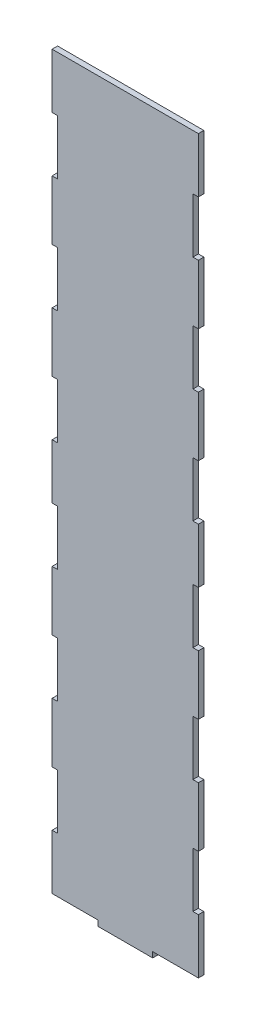
from build123d import *

# Parameters (mm, degrees)
RESSALTO_EXTRUS_O1_DEPTH = 3
ESBO_O2_OUTSIDE_W        = 248.722
ESBO_O2_OUTSIDE_H        = 491.722
CORTE_EXTRUS_O1_DEPTH    = 219.215489826
ESBO_O3_W                = 3
ESBO_O3_H                = 30
CORTE_EXTRUS_O2_DEPTH    = 219.215489826


with BuildPart() as part:
    # Esboço1 → Ressalto-extrusão1 (new body)
    with BuildSketch(Plane.XY):
        Polygon((-80, -200), (-55, -200), (-55, -203), (-25, -203), (-25, -200), (25, -200), (25, -203), (55, -203), (55, -200), (80, -200), (80, 200), (-80, 200), align=None)
    extrude(amount=RESSALTO_EXTRUS_O1_DEPTH)

    # Esboço2 outside → Corte-extrusão1 (cut, through all)
    with BuildSketch(Plane.XY.offset(3)):
        with Locations((0, -1.5)):
            Rectangle(ESBO_O2_OUTSIDE_W, ESBO_O2_OUTSIDE_H)
        Polygon((0, 200), (0, 170), (3, 170), (3, 140), (0, 140), (0, 107.5), (3, 107.5), (3, 77.5), (0, 77.5), (0, 45), (3, 45), (3, 15), (0, 15), (0, -15), (3, -15), (3, -45), (0, -45), (0, -77.5), (3, -77.5), (3, -107.5), (0, -107.5), (0, -140), (3, -140), (3, -170), (0, -170), (0, -200), (25, -200), (25, -203), (55, -203), (55, -200), (80, -200), (80, 200), align=None, mode=Mode.SUBTRACT)
    extrude(amount=-CORTE_EXTRUS_O1_DEPTH, mode=Mode.SUBTRACT)

    # Esboço3 → Corte-extrusão2 (cut, through all)
    with BuildSketch(Plane.XY.offset(3)):
        with Locations((78.5, 155)):
            Rectangle(ESBO_O3_W, ESBO_O3_H)
        with Locations((78.5, 92.5)):
            Rectangle(ESBO_O3_W, ESBO_O3_H)
        with Locations((78.5, 30)):
            Rectangle(ESBO_O3_W, ESBO_O3_H)
        with Locations((78.5, -92.5)):
            Rectangle(ESBO_O3_W, ESBO_O3_H)
        with Locations((78.5, -155)):
            Rectangle(ESBO_O3_W, ESBO_O3_H)
        with Locations((78.5, -30)):
            Rectangle(ESBO_O3_W, ESBO_O3_H)
    extrude(amount=-CORTE_EXTRUS_O2_DEPTH, mode=Mode.SUBTRACT)


solid = part.part
